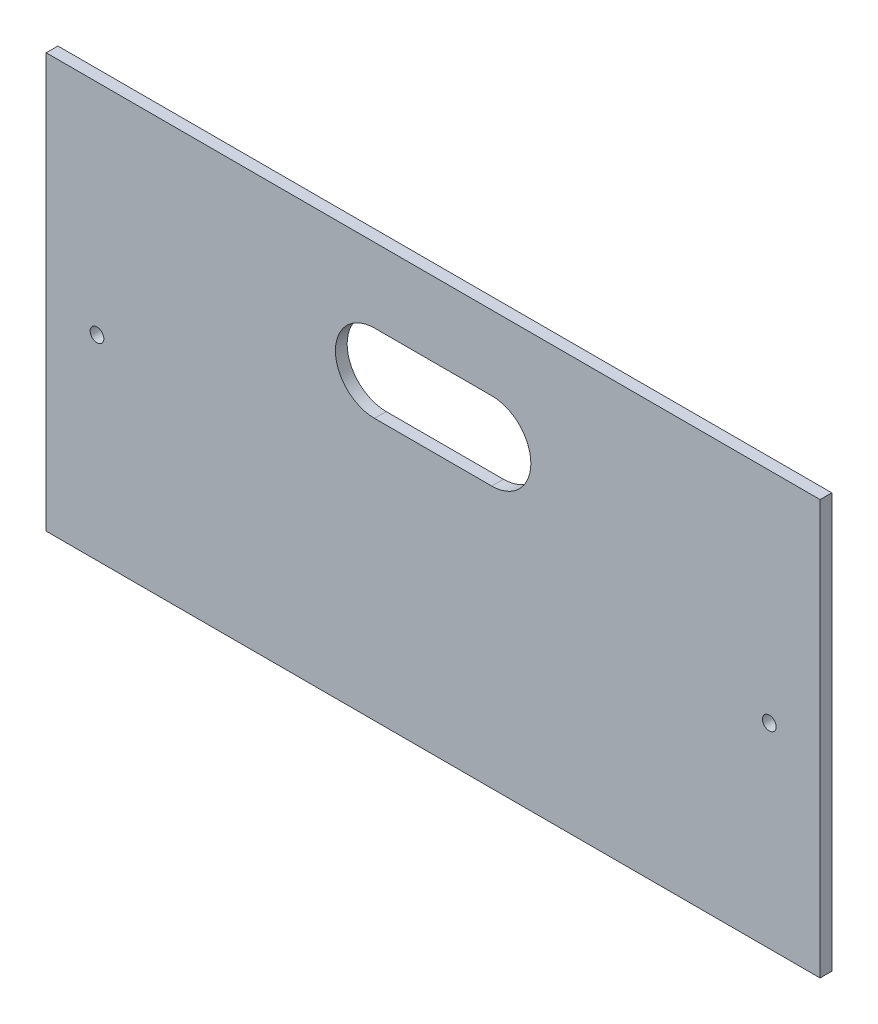
from build123d import *

# Parameters (mm, degrees)
ESQUISSE1_W             = 198
ESQUISSE1_H             = 106
ESQUISSE1_R             = 1.75
BOSS_EXTRU_1_DEPTH      = 3
ENL_V_MAT_EXTRU_1_DEPTH = 113.334322449


with BuildPart() as part:
    # Esquisse1 → Boss.-Extru.1 (new body)
    with BuildSketch(Plane.XY):
        Rectangle(ESQUISSE1_W, ESQUISSE1_H)
        with Locations((-86, -3)):
            Circle(ESQUISSE1_R, mode=Mode.SUBTRACT)
        with Locations((86, -3)):
            Circle(ESQUISSE1_R, mode=Mode.SUBTRACT)
    extrude(amount=BOSS_EXTRU_1_DEPTH)

    # Esquisse2 → Enlèv. mat.-Extru.1 (cut, through all)
    with BuildSketch(Plane(origin=(0, 0, 0), x_dir=(-1, 0, 0), z_dir=(0, 0, -1))):
        with BuildLine():
            Line((-15, 34), (15, 34))
            ThreePointArc((15, 34), (25, 24), (15, 14))
            Line((15, 14), (-15, 14))
            ThreePointArc((-15, 14), (-25, 24), (-15, 34))
        make_face()
    extrude(amount=-ENL_V_MAT_EXTRU_1_DEPTH, mode=Mode.SUBTRACT)


solid = part.part
